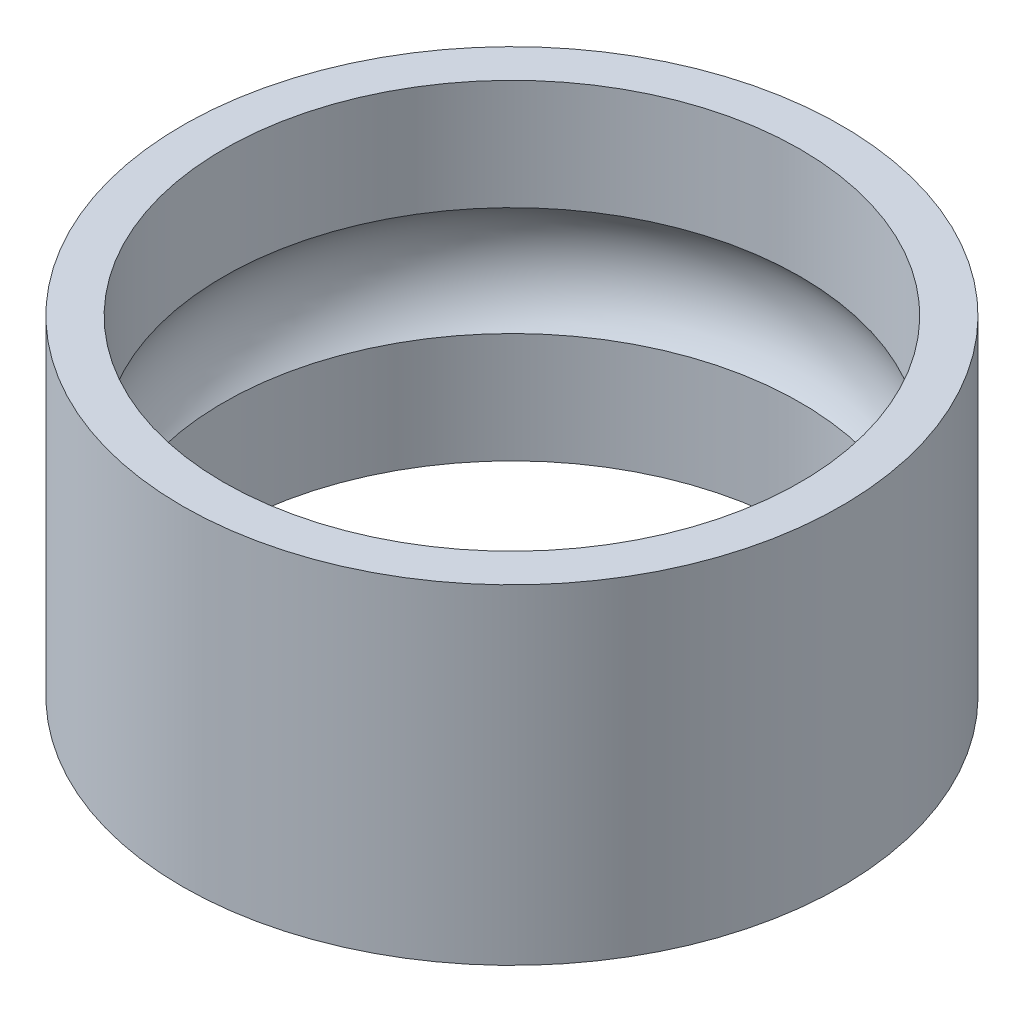
from build123d import *

# Parameters (mm, degrees)
DIAPROFILES_R         = 4
DIAPROFILES_R_2       = 3.5
DIAPROFILE_DEPTH      = 2
BEARINGPATHPROFILES_R = 1


with BuildPart() as part:
    # DiaProfileS → DiaProfile (new, symmetric)
    with BuildSketch(Plane(origin=(0, 0, 0), x_dir=(1, 0, 0), z_dir=(0, 1, 0))):
        Circle(DIAPROFILES_R)
        Circle(DIAPROFILES_R_2, mode=Mode.SUBTRACT)
    extrude(amount=DIAPROFILE_DEPTH, both=True)

    # BearingPathProfileS → BearingPathProfile (revolve, cut)
    with BuildSketch(Plane.XY):
        with Locations((2.75, 0)):
            Circle(BEARINGPATHPROFILES_R)
    revolve(axis=Axis((0, 2, 0), (0, -1, 0)), mode=Mode.SUBTRACT)


solid = part.part
